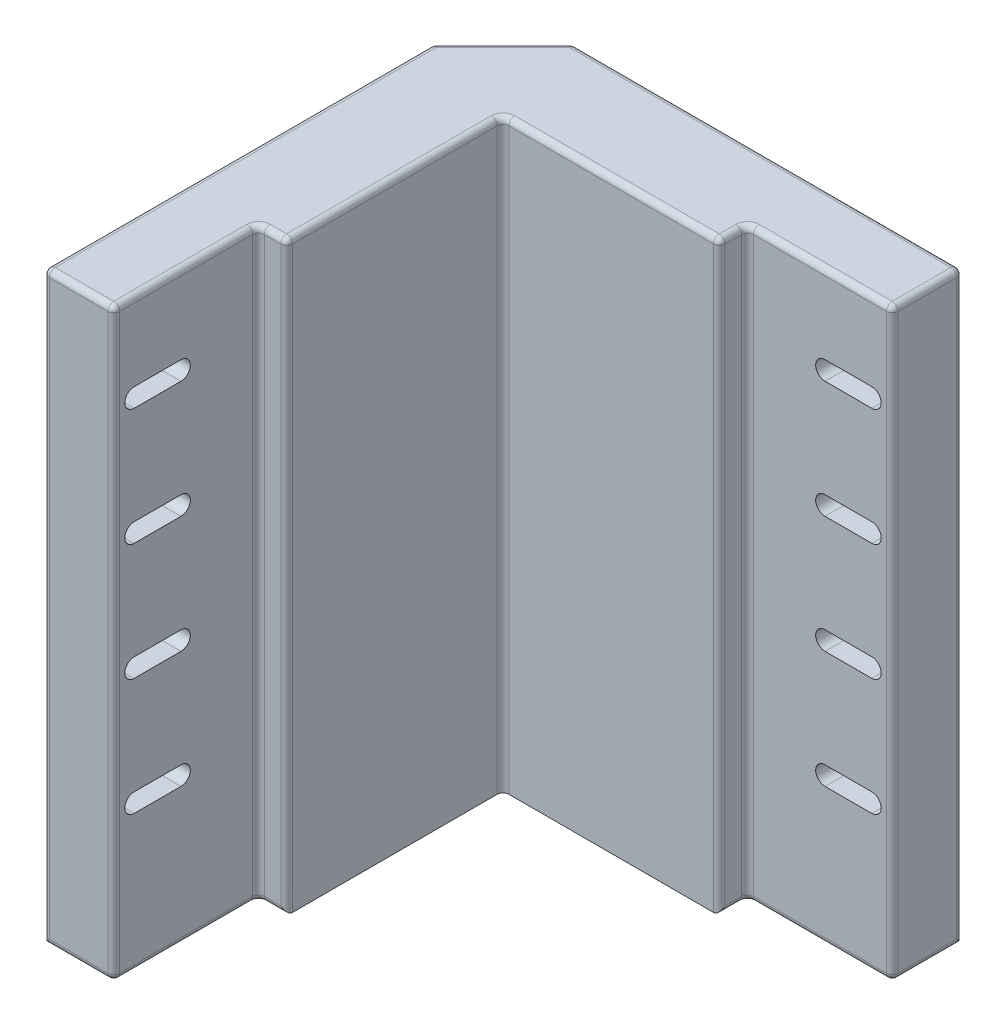
from build123d import *

# Parameters (mm, degrees)
BOSS_EXTRUDE1_DEPTH = 100
FILLET1_R           = 1
CHAMFER1_SIZE       = 12
FILLET2_R           = 1
CUT_EXTRUDE1_DEPTH  = 100
CUT_EXTRUDE2_DEPTH  = 100


with BuildPart() as part:
    # Sketch1 → Boss-Extrude1 (new body)
    with BuildSketch(Plane(origin=(0, 0, 0), x_dir=(1, 0, 0), z_dir=(0, 1, 0))):
        Polygon((0, 0), (78.57, 0), (78.57, -12), (53.8, -12), (53.8, -16.8), (16.8, -16.8), (16.8, -53.8), (12, -53.8), (12, -78.57), (0, -78.57), align=None)
    extrude(amount=BOSS_EXTRUDE1_DEPTH)

    # Fillet1
    fillet1_edges = [part.edges().sort_by_distance(p)[0] for p in [
        (78.57, 0, 6),
        (66.185, 0, 12),
        (53.8, 0, 14.4),
        (14.4, 0, 53.8),
        (12, 100, 66.185),
        (12, 0, 66.185),
        (6, 0, 78.57),
        (14.4, 100, 53.8),
        (78.57, 50, 0),
        (78.57, 50, 12),
        (53.8, 50, 12),
        (53.8, 50, 16.8),
        (16.8, 50, 16.8),
        (16.8, 50, 53.8),
        (12, 50, 53.8),
        (12, 50, 78.57),
        (0, 50, 78.57),
        (53.8, 100, 14.4),
        (66.185, 100, 12),
        (78.57, 100, 6),
        (6, 100, 78.57),
    ]]
    fillet(fillet1_edges, radius=FILLET1_R)

    # Chamfer1
    chamfer1_edges = [part.edges().sort_by_distance(p)[0] for p in [
        (0, 50, 0),
    ]]
    chamfer(chamfer1_edges, length=CHAMFER1_SIZE)

    # Fillet2
    # the kernel refuses this fillet: 1 mm, written as the material it takes off along each edge
    with BuildSketch(Plane(origin=(1, 99, 77.57), x_dir=(-1, 0, 0), z_dir=(0, 1, 0))) as fillet2_piece_1_section:
        Polygon((0, 0), (FILLET2_R, 0), (FILLET2_R, FILLET2_R), (0, FILLET2_R), align=None)
    fillet2_piece_1 = extrude(amount=FILLET2_R, mode=Mode.PRIVATE)
    fillet2_piece_1 = fillet2_piece_1 - Plane(origin=(1, 99, 77.57), x_dir=(0.7071067811865475, 0, -0.7071067811865477), z_dir=(0, 1, 0)) * Sphere(FILLET2_R, mode=Mode.PRIVATE)
    add(fillet2_piece_1, mode=Mode.SUBTRACT)
    with BuildSketch(Plane(origin=(15.8, 99, 52.8), x_dir=(1, 0, 0), z_dir=(0, 1, 0))) as fillet2_piece_2_section:
        Polygon((0, 0), (FILLET2_R, 0), (FILLET2_R, -FILLET2_R), (0, -FILLET2_R), align=None)
    fillet2_piece_2 = extrude(amount=FILLET2_R, mode=Mode.PRIVATE)
    fillet2_piece_2 = fillet2_piece_2 - Plane(origin=(15.8, 99, 52.8), x_dir=(-0.7071067811865476, 0, -0.7071067811865474), z_dir=(0, 1, 0)) * Sphere(FILLET2_R, mode=Mode.PRIVATE)
    add(fillet2_piece_2, mode=Mode.SUBTRACT)
    with BuildSketch(Plane(origin=(52.8, 99, 15.8), x_dir=(0, 0, 1), z_dir=(0, 1, 0))) as fillet2_piece_3_section:
        Polygon((0, 0), (FILLET2_R, 0), (FILLET2_R, FILLET2_R), (0, FILLET2_R), align=None)
    fillet2_piece_3 = extrude(amount=FILLET2_R, mode=Mode.PRIVATE)
    fillet2_piece_3 = fillet2_piece_3 - Plane(origin=(52.8, 99, 15.8), x_dir=(-0.7071067811865475, 0, -0.7071067811865475), z_dir=(0, 1, 0)) * Sphere(FILLET2_R, mode=Mode.PRIVATE)
    add(fillet2_piece_3, mode=Mode.SUBTRACT)
    with BuildSketch(Plane(origin=(77.57, 99, 1), x_dir=(0, 1, 0), z_dir=(0, 0, -1))) as fillet2_piece_4_section:
        Polygon((0, 0), (FILLET2_R, 0), (FILLET2_R, FILLET2_R), (0, FILLET2_R), align=None)
    fillet2_piece_4 = extrude(amount=FILLET2_R, mode=Mode.PRIVATE)
    fillet2_piece_4 = fillet2_piece_4 - Plane(origin=(77.57, 99, 1), x_dir=(-0.7071067811865475, -0.7071067811865475, 0), z_dir=(0, 0, -1)) * Sphere(FILLET2_R, mode=Mode.PRIVATE)
    add(fillet2_piece_4, mode=Mode.SUBTRACT)
    with BuildSketch(Plane(origin=(1, 99, 12.414213562), x_dir=(-1, 0, 0), z_dir=(0, 1, 0))) as fillet2_piece_5_section:
        Polygon((0, 0), (FILLET2_R, 0), (FILLET2_R, -FILLET2_R * 0.414213562373), (FILLET2_R * 0.707106781187, -FILLET2_R * 0.707106781187), align=None)
    fillet2_piece_5 = extrude(amount=FILLET2_R, mode=Mode.PRIVATE)
    fillet2_piece_5 = fillet2_piece_5 - Plane(origin=(1, 99, 12.414213562), x_dir=(0.9238795325112868, 0, 0.3826834323650896), z_dir=(0, 1, 0)) * Sphere(FILLET2_R, mode=Mode.PRIVATE)
    add(fillet2_piece_5, mode=Mode.SUBTRACT)
    with BuildSketch(Plane(origin=(12.414213562, 99, 1), x_dir=(0, 0, -1), z_dir=(0, 1, 0))) as fillet2_piece_6_section:
        Polygon((0, 0), (FILLET2_R, 0), (FILLET2_R, FILLET2_R * 0.414213562373), (FILLET2_R * 0.707106781187, FILLET2_R * 0.707106781187), align=None)
    fillet2_piece_6 = extrude(amount=FILLET2_R, mode=Mode.PRIVATE)
    fillet2_piece_6 = fillet2_piece_6 - Plane(origin=(12.414213562, 99, 1), x_dir=(0.3826834323650898, 0, 0.9238795325112867), z_dir=(0, 1, 0)) * Sphere(FILLET2_R, mode=Mode.PRIVATE)
    add(fillet2_piece_6, mode=Mode.SUBTRACT)
    with BuildSketch(Plane(origin=(0, 100, 77.57), x_dir=(1, 0, 0), z_dir=(0, 0, -1))) as fillet2_piece_7:
        with BuildLine():
            CenterArc((FILLET2_R, FILLET2_R), FILLET2_R, 180, 90)
            Line((0, FILLET2_R), (0, 0))
            Line((0, 0), (FILLET2_R, 0))
        make_face()
    extrude(amount=65.155786438, mode=Mode.SUBTRACT)
    with BuildSketch(Plane(origin=(0, -1.035533906, 12), x_dir=(0.7071067811865466, 0, -0.7071067811865485), z_dir=(0, 1, 0)), Plane(origin=(12, -1.035533906, 0), x_dir=(1, 0, 0), z_dir=(0, 1, 0))) as fillet2_piece_8:
        with BuildLine():
            CenterArc((FILLET2_R * 0.414213562373, -FILLET2_R), FILLET2_R, 90, 45)
            Line((-FILLET2_R * 0.292893218813, -FILLET2_R * 0.292893218813), (0, 0))
            Line((0, 0), (FILLET2_R * 0.414213562373, 0))
        make_face()
    extrude(amount=100.035533906, mode=Mode.SUBTRACT)
    with BuildSketch(Plane(origin=(11.707106781, 100, 0.292893219), x_dir=(0, -1, 0), z_dir=(-0.7071067811865475, 0, 0.7071067811865476))) as fillet2_piece_9:
        with BuildLine():
            CenterArc((FILLET2_R, FILLET2_R), FILLET2_R, 180, 90)
            Line((0, FILLET2_R), (0, 0))
            Line((0, 0), (FILLET2_R, 0))
        make_face()
    extrude(amount=16.142135624, mode=Mode.SUBTRACT)
    with BuildSketch(Plane(origin=(16.8, 100, 17.8), x_dir=(-1, 0, 0), z_dir=(0, 0, 1)), Plane(origin=(52.8, 100, 16.8), x_dir=(0, 0, -1), z_dir=(-1, 0, 0))) as fillet2_piece_10:
        with BuildLine():
            CenterArc((FILLET2_R, FILLET2_R), FILLET2_R, 180, 90)
            Line((0, FILLET2_R), (0, 0))
            Line((0, 0), (FILLET2_R, 0))
        make_face()
    extrude(amount=35, mode=Mode.SUBTRACT)
    with BuildSketch(Plane(origin=(12.414213562, 100, 0), x_dir=(0, -1, 0), z_dir=(1, 0, 0))) as fillet2_piece_11:
        with BuildLine():
            CenterArc((FILLET2_R, -FILLET2_R), FILLET2_R, 90, 90)
            Line((0, -FILLET2_R), (0, 0))
            Line((0, 0), (FILLET2_R, 0))
        make_face()
    extrude(amount=65.155786438, mode=Mode.SUBTRACT)
    with BuildSketch(Plane(origin=(17.8, 100, 17.8), x_dir=(0, 0, -1), z_dir=(1, 0, 0))) as fillet2_piece_12:
        with BuildLine():
            CenterArc((1 + FILLET2_R, -FILLET2_R), FILLET2_R, 90, 90)
            Line((1, -FILLET2_R), (1, 0))
            Line((1, 0), (1 + FILLET2_R, 0))
        make_face()
    revolve(axis=Axis((17.8, 100, 17.8), (0, 1, 0)), revolution_arc=90, mode=Mode.SUBTRACT)

    # Sketch2 → Cut-Extrude1 (cut)
    with BuildSketch(Plane(origin=(12, 0, 0), x_dir=(0, 0, -1), z_dir=(1, 0, 0))):
        with BuildLine():
            Line((-75.07, 86.6), (-67.07, 86.6))
            ThreePointArc((-67.07, 86.6), (-65.47, 85), (-67.07, 83.4))
            Line((-67.07, 83.4), (-75.07, 83.4))
            ThreePointArc((-75.07, 83.4), (-76.67, 85), (-75.07, 86.6))
        make_face()
        with BuildLine():
            Line((-75.07, 66.6), (-67.07, 66.6))
            ThreePointArc((-67.07, 66.6), (-65.47, 65), (-67.07, 63.4))
            Line((-67.07, 63.4), (-75.07, 63.4))
            ThreePointArc((-75.07, 63.4), (-76.67, 65), (-75.07, 66.6))
        make_face()
        with BuildLine():
            Line((-75.07, 46.6), (-67.07, 46.6))
            ThreePointArc((-67.07, 46.6), (-65.47, 45), (-67.07, 43.4))
            Line((-67.07, 43.4), (-75.07, 43.4))
            ThreePointArc((-75.07, 43.4), (-76.67, 45), (-75.07, 46.6))
        make_face()
        with BuildLine():
            Line((-75.07, 26.6), (-67.07, 26.6))
            ThreePointArc((-67.07, 26.6), (-65.47, 25), (-67.07, 23.4))
            Line((-67.07, 23.4), (-75.07, 23.4))
            ThreePointArc((-75.07, 23.4), (-76.67, 25), (-75.07, 26.6))
        make_face()
    extrude(amount=-CUT_EXTRUDE1_DEPTH, mode=Mode.SUBTRACT)

    # Sketch3 → Cut-Extrude2 (cut)
    with BuildSketch(Plane.XY.offset(12)):
        with BuildLine():
            Line((67.07, 86.6), (75.07, 86.6))
            ThreePointArc((75.07, 86.6), (76.67, 85), (75.07, 83.4))
            Line((75.07, 83.4), (67.07, 83.4))
            ThreePointArc((67.07, 83.4), (65.47, 85), (67.07, 86.6))
        make_face()
        with BuildLine():
            Line((67.07, 66.6), (75.07, 66.6))
            ThreePointArc((75.07, 66.6), (76.67, 65), (75.07, 63.4))
            Line((75.07, 63.4), (67.07, 63.4))
            ThreePointArc((67.07, 63.4), (65.47, 65), (67.07, 66.6))
        make_face()
        with BuildLine():
            Line((67.07, 46.6), (75.07, 46.6))
            ThreePointArc((75.07, 46.6), (76.67, 45), (75.07, 43.4))
            Line((75.07, 43.4), (67.07, 43.4))
            ThreePointArc((67.07, 43.4), (65.47, 45), (67.07, 46.6))
        make_face()
        with BuildLine():
            Line((67.07, 26.6), (75.07, 26.6))
            ThreePointArc((75.07, 26.6), (76.67, 25), (75.07, 23.4))
            Line((75.07, 23.4), (67.07, 23.4))
            ThreePointArc((67.07, 23.4), (65.47, 25), (67.07, 26.6))
        make_face()
    extrude(amount=-CUT_EXTRUDE2_DEPTH, mode=Mode.SUBTRACT)


solid = part.part
